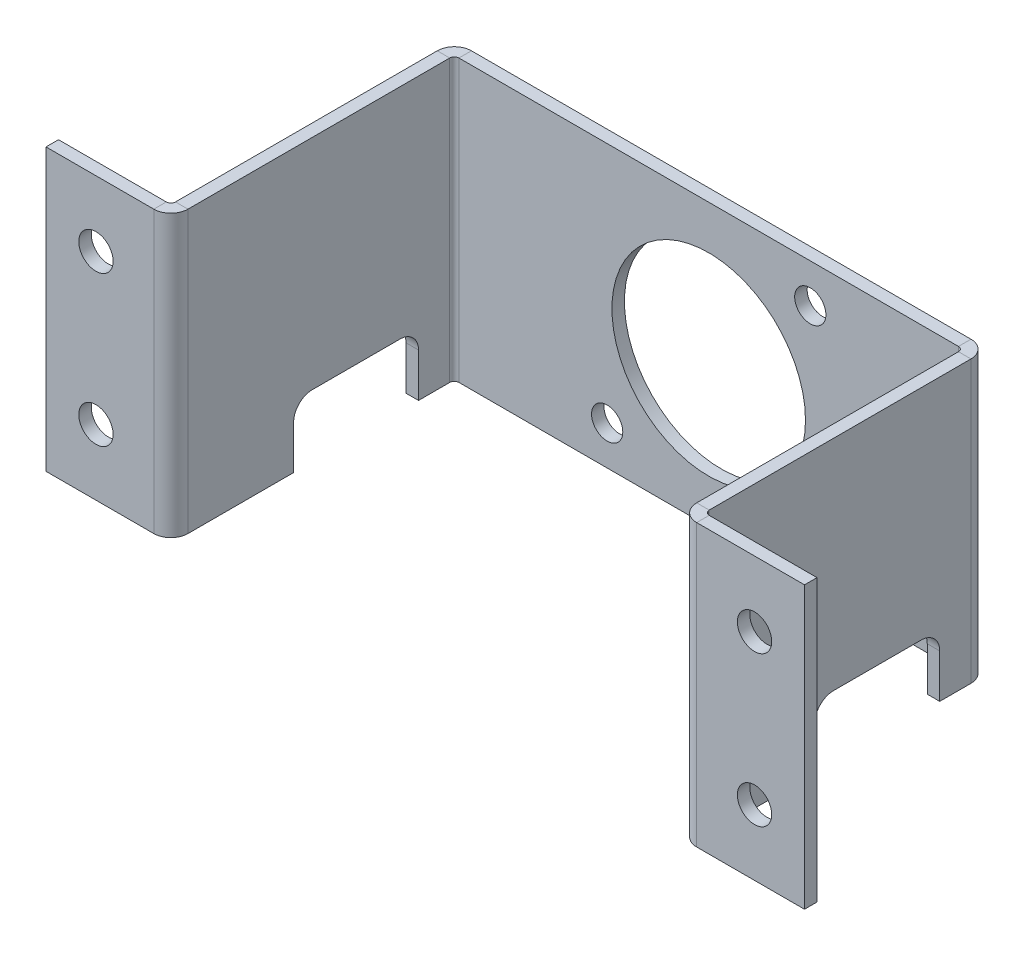
from build123d import *

# Parameters (mm, degrees)
SKETCH2_W               = 80
SKETCH2_H               = 45
BASE_FLANGE1_DEPTH      = 2
EDGE_FLANGE1_DEPTH      = 45
EDGE_FLANGE2_DEPTH      = 45
SKETCH13_R              = 15.5
CUT_EXTRUDE1_DEPTH      = 65.440224857
SKETCH14_R              = 2.5
CUT_EXTRUDE2_DEPTH      = 65.440224857
EDGE_FLANGE3_DEPTH      = 45
EDGE_FLANGE3_BEND_DEPTH = 45
SKETCH21_R              = 2.75
CUT_EXTRUDE3_DEPTH      = 81.259717612
CUT_EXTRUDE4_DEPTH      = 116.211997682


# Sheet-metal steps are written as plain solids
with BuildPart() as part:
    # Sketch2 → Base-Flange1 (new body)
    with BuildSketch(Plane.XY):
        Rectangle(SKETCH2_W, SKETCH2_H)
    extrude(amount=-BASE_FLANGE1_DEPTH)

    # Edge-Flange1 section (across the edge) → Edge-Flange1 (add)
    with BuildSketch(Plane(origin=(40.7366, -22.5, 0), x_dir=(-1, 0, 0), z_dir=(0, 1, 0))):
        with BuildLine():
            Line((-2, 0.7366), (-2, 42.66))
            Line((-2, 42.66), (0, 42.66))
            Line((0, 42.66), (0, 0.7366))
            ThreePointArc((0, 0.7366), (0.215745145, 0.215745145), (0.7366, 0))
            Line((0.7366, 0), (0.7366, -2))
            ThreePointArc((0.7366, -2), (-1.198468417, -1.198468417), (-2, 0.7366))
        make_face()
    extrude(amount=EDGE_FLANGE1_DEPTH)

    # Edge-Flange2 section (across the edge) → Edge-Flange2 (add)
    with BuildSketch(Plane(origin=(-40.7366, 22.5, 0), x_dir=(1, 0, 0), z_dir=(0, -1, 0))):
        with BuildLine():
            Line((-2, 0.7366), (-2, 42.66))
            Line((-2, 42.66), (0, 42.66))
            Line((0, 42.66), (0, 0.7366))
            ThreePointArc((0, 0.7366), (0.215745145, 0.215745145), (0.7366, 0))
            Line((0.7366, 0), (0.7366, -2))
            ThreePointArc((0.7366, -2), (-1.198468417, -1.198468417), (-2, 0.7366))
        make_face()
    extrude(amount=EDGE_FLANGE2_DEPTH)

    # Sketch13 → Cut-Extrude1 (cut, through all)
    with BuildSketch(Plane.XY):
        Circle(SKETCH13_R)
    extrude(amount=-CUT_EXTRUDE1_DEPTH, mode=Mode.SUBTRACT)

    # Sketch14 → Cut-Extrude2 (cut, through all)
    with BuildSketch(Plane.XY):
        with Locations((-16.263455967, -16.263455967)):
            Circle(SKETCH14_R)
        with Locations((16.263455967, 16.263455967)):
            Circle(SKETCH14_R)
    extrude(amount=-CUT_EXTRUDE2_DEPTH, mode=Mode.SUBTRACT)

    # Edge-Flange3 section (across the edge) → Edge-Flange3 (add)
    with BuildSketch(Plane(origin=(42.7366, 22.5, 43.3966), x_dir=(0, 0, -1), z_dir=(0, -1, 0))):
        with BuildLine():
            Line((-2, 0.7366), (-2, 18))
            Line((-2, 18), (0, 18))
            Line((0, 18), (0, 0.7366))
            ThreePointArc((0, 0.7366), (0.215745145, 0.215745145), (0.7366, 0))
            Line((0.7366, 0), (0.7366, -2))
            ThreePointArc((0.7366, -2), (-1.198468417, -1.198468417), (-2, 0.7366))
        make_face()
    extrude(amount=EDGE_FLANGE3_DEPTH)

    # Edge-Flange3 section 2 (across the edge) → Edge-Flange3 bend (add)
    with BuildSketch(Plane(origin=(-42.7366, -22.5, 43.3966), x_dir=(0, 0, -1), z_dir=(0, 1, 0))):
        with BuildLine():
            Line((-2, 0.7366), (-2, 18))
            Line((-2, 18), (0, 18))
            Line((0, 18), (0, 0.7366))
            ThreePointArc((0, 0.7366), (0.215745145, 0.215745145), (0.7366, 0))
            Line((0.7366, 0), (0.7366, -2))
            ThreePointArc((0.7366, -2), (-1.198468417, -1.198468417), (-2, 0.7366))
        make_face()
    extrude(amount=EDGE_FLANGE3_BEND_DEPTH)

    # Sketch21 → Cut-Extrude3 (cut, through all)
    with BuildSketch(Plane.XY.offset(45.3966)):
        with Locations((52.7366, 12)):
            Circle(SKETCH21_R)
        with Locations((52.7366, -12)):
            Circle(SKETCH21_R)
        with Locations((-52.7366, 12)):
            Circle(SKETCH21_R)
        with Locations((-52.7366, -12)):
            Circle(SKETCH21_R)
    extrude(amount=-CUT_EXTRUDE3_DEPTH, mode=Mode.SUBTRACT)

    # Sketch22 → Cut-Extrude4 (cut, through all)
    with BuildSketch(Plane(origin=(42.7366, 0, 0), x_dir=(0, 0, -1), z_dir=(1, 0, 0))):
        with BuildLine():
            Line((-5.7366, -22.5), (-25.7366, -22.5))
            Line((-25.7366, -22.5), (-25.7366, -15.5))
            ThreePointArc((-25.7366, -15.5), (-24.857920344, -13.378679656), (-22.7366, -12.5))
            Line((-22.7366, -12.5), (-8.7366, -12.5))
            ThreePointArc((-8.7366, -12.5), (-6.615279656, -13.378679656), (-5.7366, -15.5))
            Line((-5.7366, -15.5), (-5.7366, -22.5))
        make_face()
    extrude(amount=-CUT_EXTRUDE4_DEPTH, mode=Mode.SUBTRACT)


solid = part.part
